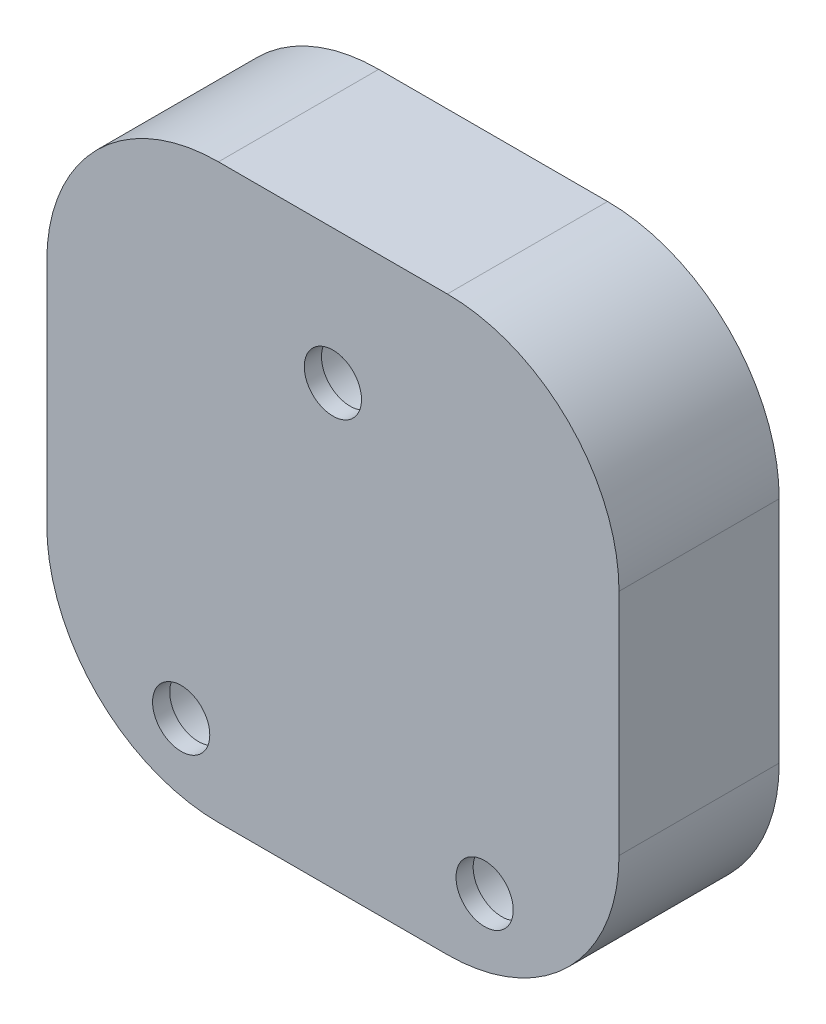
from build123d import *

# Parameters (mm, degrees)
SKETCH1_W           = 100
SKETCH1_H           = 100
SKETCH1_R           = 4
SKETCH1_R_2         = 8.1
BOSS_EXTRUDE1_DEPTH = 25
SKETCH2_W           = 100
SKETCH2_H           = 100
SKETCH2_R           = 5
BOSS_EXTRUDE2_DEPTH = 3
FILLET1_R           = 30
FILLET2_R           = 3
SKETCH3_R           = 6
CUT_EXTRUDE1_DEPTH  = 10
FILLET3_R           = 3


with BuildPart() as part:
    # Sketch1 → Boss-Extrude1 (new body)
    with BuildSketch(Plane.XY):
        with Locations((0, 37.5)):
            Rectangle(SKETCH1_W, SKETCH1_H)
        Circle(SKETCH1_R, mode=Mode.SUBTRACT)
        with Locations((26.516504294, 64.016504294)):
            Circle(SKETCH1_R, mode=Mode.SUBTRACT)
        with Locations((-26.516504294, 64.016504294)):
            Circle(SKETCH1_R, mode=Mode.SUBTRACT)
        with Locations((0, 64.016504294)):
            Circle(SKETCH1_R_2, mode=Mode.SUBTRACT)
        with Locations((-26.516504294, 0)):
            Circle(SKETCH1_R_2, mode=Mode.SUBTRACT)
        with Locations((26.516504294, 0)):
            Circle(SKETCH1_R_2, mode=Mode.SUBTRACT)
    extrude(amount=-BOSS_EXTRUDE1_DEPTH)

    # Sketch2 → Boss-Extrude2 (add)
    with BuildSketch(Plane.XY):
        with Locations((0, 37.5)):
            Rectangle(SKETCH2_W, SKETCH2_H)
        with Locations((0, 64.016504293)):
            Circle(SKETCH2_R, mode=Mode.SUBTRACT)
        with Locations((26.516504294, -1e-09)):
            Circle(SKETCH2_R, mode=Mode.SUBTRACT)
        with Locations((-26.516504294, -1e-09)):
            Circle(SKETCH2_R, mode=Mode.SUBTRACT)
    extrude(amount=BOSS_EXTRUDE2_DEPTH)

    # Fillet1
    fillet1_edges = [part.edges().sort_by_distance(p)[0] for p in [
        (50, 87.5, -11),
        (-50, 87.5, -11),
        (50, -12.5, -11),
        (-50, -12.5, -11),
    ]]
    fillet(fillet1_edges, radius=FILLET1_R)

    # Fillet2
    fillet2_edges = [part.edges().sort_by_distance(p)[0] for p in [
        (18.416504295, 0, -25),
        (-34.616504294, 0, -25),
        (-8.1, 64.016504294, -25),
    ]]
    fillet(fillet2_edges, radius=FILLET2_R)

    # Sketch3 → Cut-Extrude1 (cut)
    with BuildSketch(Plane(origin=(0, 0, -25), x_dir=(-1, 0, 0), z_dir=(0, 0, -1))):
        with Locations((0, 37.5)):
            Circle(SKETCH3_R)
    extrude(amount=-CUT_EXTRUDE1_DEPTH, mode=Mode.SUBTRACT)

    # Fillet3
    fillet3_edges = [part.edges().sort_by_distance(p)[0] for p in [
        (6, 37.5, -25),
    ]]
    fillet(fillet3_edges, radius=FILLET3_R)


solid = part.part
